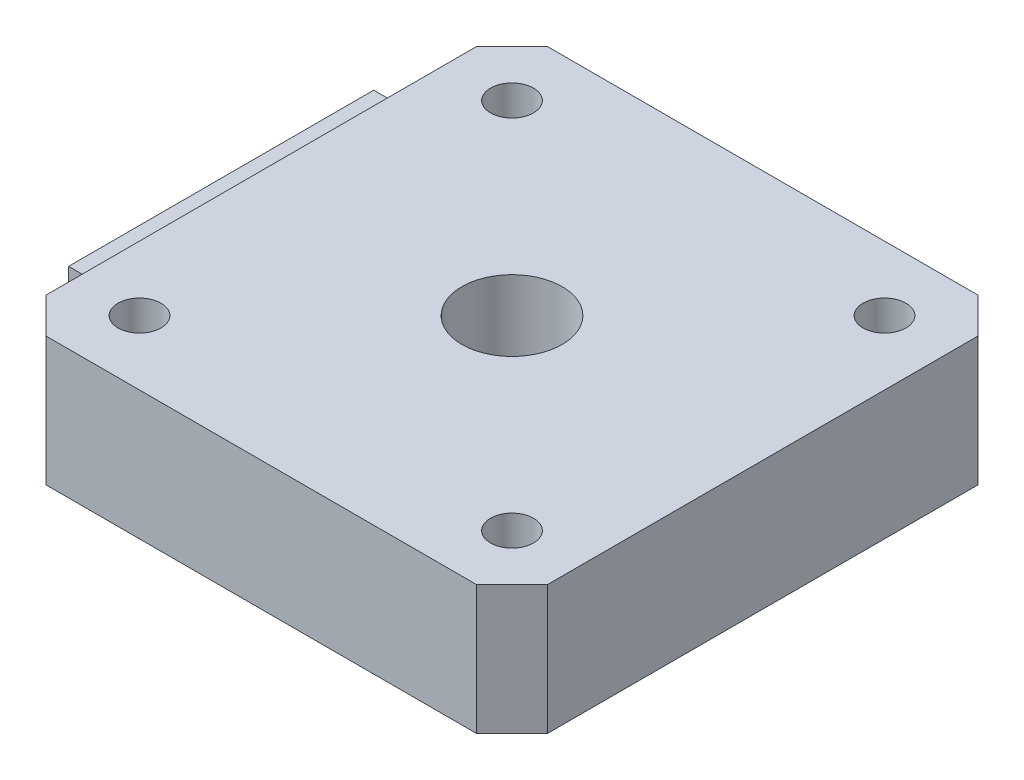
from build123d import *

# Parameters (mm, degrees)
SALIENTE_EXTRUIR1_DEPTH = 9
CROQUIS2_R              = 3.5
CORTAR_EXTRUIR1_DEPTH   = 51.309044912
CROQUIS3_R              = 1.5
CORTAR_EXTRUIR2_DEPTH   = 51.309044912
SKETCH1_W               = 21.3
SKETCH1_H               = 7.15
BOSS_EXTRUDE1_DEPTH     = 2.8
SKETCH2_W               = 20
SKETCH2_H               = 6
CUT_EXTRUDE1_DEPTH      = 2.8


with BuildPart() as part:
    # Croquis1 → Saliente-Extruir1 (new body)
    with BuildSketch(Plane(origin=(0, 0, 0), x_dir=(1, 0, 0), z_dir=(0, 1, 0))):
        Polygon((0, 2.473088065), (2.473088065, 0), (32.526911935, 0), (35, 2.473088065), (35, 32.526911935), (32.526911935, 35), (2.473088065, 35), (0, 32.526911935), align=None)
    extrude(amount=SALIENTE_EXTRUIR1_DEPTH)

    # Croquis2 → Cortar-Extruir1 (cut, through all)
    with BuildSketch(Plane(origin=(0, 9, 0), x_dir=(1, 0, 0), z_dir=(0, 1, 0))):
        with Locations((17.5, 17.5)):
            Circle(CROQUIS2_R)
    extrude(amount=-CORTAR_EXTRUIR1_DEPTH, mode=Mode.SUBTRACT)

    # Croquis3 → Cortar-Extruir2 (cut, through all)
    with BuildSketch(Plane(origin=(0, 9, 0), x_dir=(1, 0, 0), z_dir=(0, 1, 0))):
        with Locations((4.5, 30.5)):
            Circle(CROQUIS3_R)
        with Locations((30.5, 30.5)):
            Circle(CROQUIS3_R)
        with Locations((30.5, 4.5)):
            Circle(CROQUIS3_R)
        with Locations((4.5, 4.5)):
            Circle(CROQUIS3_R)
    extrude(amount=-CORTAR_EXTRUIR2_DEPTH, mode=Mode.SUBTRACT)

    # Sketch1 → Boss-Extrude1 (add)
    with BuildSketch(Plane.ZY):
        with Locations((-17.5, 3.575)):
            Rectangle(SKETCH1_W, SKETCH1_H)
    extrude(amount=BOSS_EXTRUDE1_DEPTH)

    # Sketch2 → Cut-Extrude1 (cut)
    with BuildSketch(Plane.ZY.offset(2.8)):
        with Locations((-17.5, 3.575)):
            Rectangle(SKETCH2_W, SKETCH2_H)
    extrude(amount=-CUT_EXTRUDE1_DEPTH, mode=Mode.SUBTRACT)


solid = part.part
